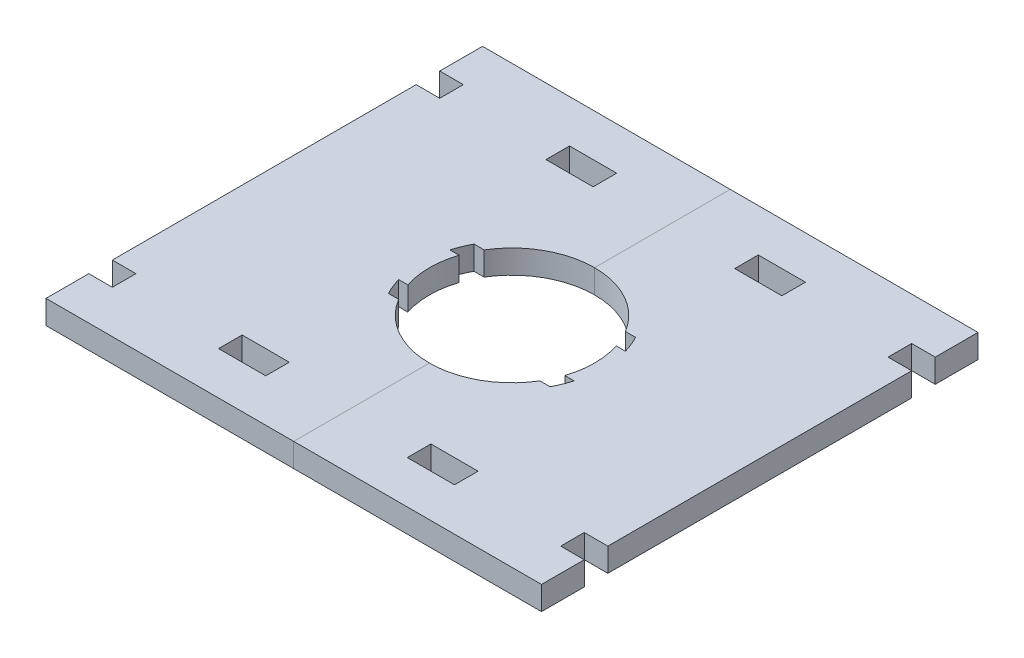
from build123d import *

# Parameters (mm, degrees)
SKETCH2_W               = 84
SKETCH2_H               = 74
BOSS_EXTRUDE1_DEPTH     = 4
CUT_EXTRUDE2_DEPTH      = 57.115951386
CUT_EXTRUDE2_DEPTH_BACK = 57.115951386
SKETCH4_W               = 8
SKETCH4_H               = 4
SKETCH4_W_2             = 4


with BuildPart() as part:
    # Sketch2 → Boss-Extrude1 (new body)
    with BuildSketch(Plane(origin=(0, 0, 0), x_dir=(1, 0, 0), z_dir=(0, 1, 0))):
        Rectangle(SKETCH2_W, SKETCH2_H)
        with BuildLine():
            ThreePointArc((13.307047005, 4.35), (14, 0), (13.307047005, -4.35))
            Line((13.307047005, -4.35), (14.877079687, -4.35))
            ThreePointArc((14.877079687, -4.35), (14.361878956, -5.829788405), (13.699908759, -7.25))
            Line((13.699908759, -7.25), (11.976539567, -7.25))
            ThreePointArc((11.976539567, -7.25), (0, -14), (-11.976539567, -7.25))
            Line((-11.976539567, -7.25), (-13.699908759, -7.25))
            ThreePointArc((-13.699908759, -7.25), (-14.361878956, -5.829788405), (-14.877079687, -4.35))
            Line((-14.877079687, -4.35), (-13.307047005, -4.35))
            ThreePointArc((-13.307047005, -4.35), (-14, 0), (-13.307047005, 4.35))
            Line((-13.307047005, 4.35), (-14.877079687, 4.35))
            ThreePointArc((-14.877079687, 4.35), (-14.361878956, 5.829788405), (-13.699908759, 7.25))
            Line((-13.699908759, 7.25), (-11.976539567, 7.25))
            ThreePointArc((-11.976539567, 7.25), (0, 14), (11.976539567, 7.25))
            Line((11.976539567, 7.25), (13.699908759, 7.25))
            ThreePointArc((13.699908759, 7.25), (14.361878956, 5.829788405), (14.877079687, 4.35))
            Line((14.877079687, 4.35), (13.307047005, 4.35))
        make_face(mode=Mode.SUBTRACT)
    extrude(amount=BOSS_EXTRUDE1_DEPTH)


with BuildPart() as body_2:
    # Split1: the piece on the far side of the plane
    add(part.part)
    split(bisect_by=Plane(origin=(0, 0, 0), x_dir=(0, 0, 1), z_dir=(1, 0, 0)), keep=Keep.BOTTOM)


with BuildPart() as part_1:
    add(part.part)

    # Split1
    split(bisect_by=Plane(origin=(0, 0, 0), x_dir=(0, 0, 1), z_dir=(1, 0, 0)), keep=Keep.TOP)


with BuildPart() as cut_extrude2_tool:
    # Sketch4 → Cut-Extrude2 (new, two sides: drawn at the far end of the back side and taken through both)
    with BuildSketch(Plane(origin=(0, 4, 0), x_dir=(1, 0, 0), z_dir=(0, 1, 0)).offset(-CUT_EXTRUDE2_DEPTH_BACK)):
        with Locations((-16, -27.75)):
            Rectangle(SKETCH4_W, SKETCH4_H)
        with Locations((-40, -27.75)):
            Rectangle(SKETCH4_W_2, SKETCH4_H)
        with Locations((40, -27.75)):
            Rectangle(SKETCH4_W_2, SKETCH4_H)
        with Locations((16, -27.75)):
            Rectangle(SKETCH4_W, SKETCH4_H)
        with Locations((16, 27.75)):
            Rectangle(SKETCH4_W, SKETCH4_H)
        with Locations((40, 27.75)):
            Rectangle(SKETCH4_W_2, SKETCH4_H)
        with Locations((-40, 27.75)):
            Rectangle(SKETCH4_W_2, SKETCH4_H)
        with Locations((-16, 27.75)):
            Rectangle(SKETCH4_W, SKETCH4_H)
    extrude(amount=CUT_EXTRUDE2_DEPTH + CUT_EXTRUDE2_DEPTH_BACK)


with BuildPart() as part_2:
    add(part_1.part)

    # Cut-Extrude2: cut by cut_extrude2_tool
    add(cut_extrude2_tool.part, mode=Mode.SUBTRACT)


with BuildPart() as body_2_1:
    add(body_2.part)

    # Cut-Extrude2: cut by cut_extrude2_tool
    add(cut_extrude2_tool.part, mode=Mode.SUBTRACT)


solid = Compound([part_2.part, body_2_1.part])
